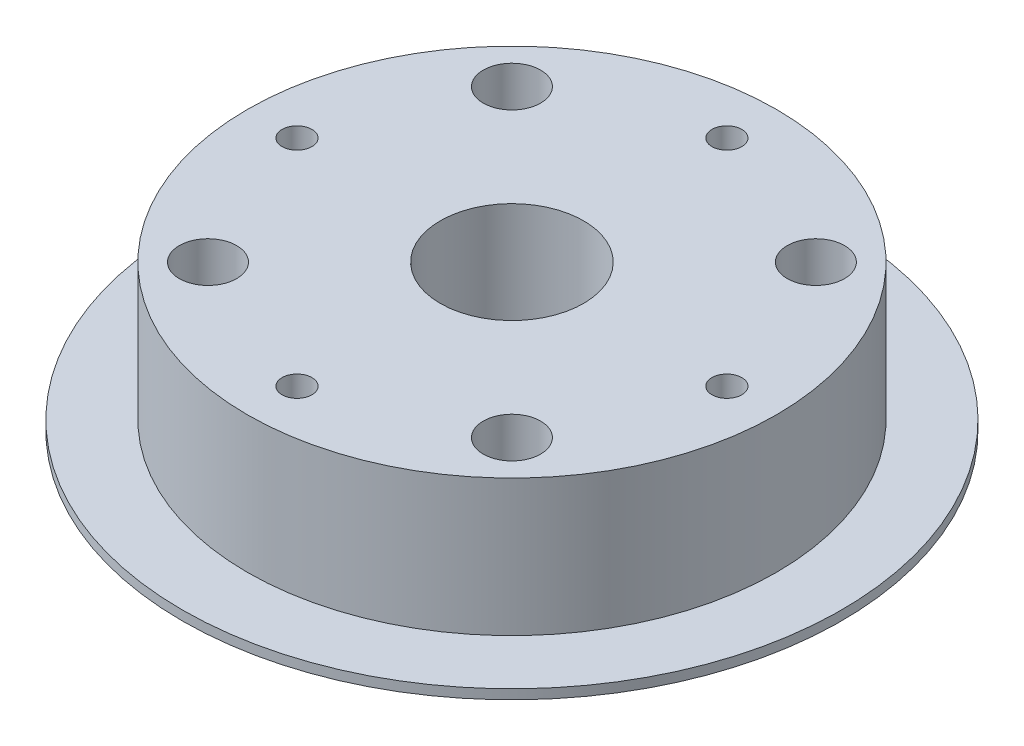
from build123d import *

# Parameters (mm, degrees)
SKETCH1_R           = 34.5
SKETCH1_R_2         = 1.5635
SKETCH1_R_3         = 7.5
BOSS_EXTRUDE1_DEPTH = 1
BOSS_EXTRUDE2_START = 14.2875
SKETCH1_3_R         = 27.69
SKETCH1_3_R_2       = 7.5
SKETCH1_3_R_3       = 1.5635
BOSS_EXTRUDE2_DEPTH = 14.2875
SKETCH2_R           = 3
SKETCH2_R_2         = 1.5635
CUT_EXTRUDE1_DEPTH  = 4.7625
CUT_EXTRUDE4_START  = -1
CUT_EXTRUDE4_DEPTH  = 4.7625


with BuildPart() as part:
    # Sketch1 → Boss-Extrude1 (new body)
    with BuildSketch(Plane(origin=(0, 0, 0), x_dir=(1, 0, 0), z_dir=(0, 1, 0))):
        Circle(SKETCH1_R)
        with Locations((22.5, 0)):
            Circle(SKETCH1_R_2, mode=Mode.SUBTRACT)
        with Locations((-15.909902577, -15.909902577)):
            Circle(SKETCH1_R_2, mode=Mode.SUBTRACT)
        with Locations((0, -22.5)):
            Circle(SKETCH1_R_2, mode=Mode.SUBTRACT)
        with Locations((15.909902577, -15.909902577)):
            Circle(SKETCH1_R_2, mode=Mode.SUBTRACT)
        with Locations((-22.5, 0)):
            Circle(SKETCH1_R_2, mode=Mode.SUBTRACT)
        with Locations((-15.909902577, 15.909902577)):
            Circle(SKETCH1_R_2, mode=Mode.SUBTRACT)
        with Locations((0, 22.5)):
            Circle(SKETCH1_R_2, mode=Mode.SUBTRACT)
        with Locations((15.909902577, 15.909902577)):
            Circle(SKETCH1_R_2, mode=Mode.SUBTRACT)
        Circle(SKETCH1_R_3, mode=Mode.SUBTRACT)
    extrude(amount=-BOSS_EXTRUDE1_DEPTH)

    # Sketch1<3> → Boss-Extrude2 (add)
    with BuildSketch(Plane(origin=(0, 0, 0), x_dir=(1, 0, 0), z_dir=(0, 1, 0)).offset(BOSS_EXTRUDE2_START)):
        Circle(SKETCH1_3_R)
        Circle(SKETCH1_3_R_2, mode=Mode.SUBTRACT)
        with Locations((-15.909902577, -15.909902577)):
            Circle(SKETCH1_3_R_3, mode=Mode.SUBTRACT)
        with Locations((0, -22.5)):
            Circle(SKETCH1_3_R_3, mode=Mode.SUBTRACT)
        with Locations((15.909902577, -15.909902577)):
            Circle(SKETCH1_3_R_3, mode=Mode.SUBTRACT)
        with Locations((-22.5, 0)):
            Circle(SKETCH1_3_R_3, mode=Mode.SUBTRACT)
        with Locations((-15.909902577, 15.909902577)):
            Circle(SKETCH1_3_R_3, mode=Mode.SUBTRACT)
        with Locations((0, 22.5)):
            Circle(SKETCH1_3_R_3, mode=Mode.SUBTRACT)
        with Locations((22.5, 0)):
            Circle(SKETCH1_3_R_3, mode=Mode.SUBTRACT)
        with Locations((15.909902577, 15.909902577)):
            Circle(SKETCH1_3_R_3, mode=Mode.SUBTRACT)
    extrude(amount=-BOSS_EXTRUDE2_DEPTH)

    # Sketch2 → Cut-Extrude1 (cut)
    # profile 1 of 4: a face of its own
    with BuildSketch(Plane(origin=(0, 14.2875, 0), x_dir=(1, 0, 0), z_dir=(0, 1, 0))):
        with Locations((15.909902577, 15.909902577)):
            Circle(SKETCH2_R)
        with Locations((15.909902577, 15.909902577)):
            Circle(SKETCH2_R_2, mode=Mode.SUBTRACT)
    # profile 2 of 4: a face of its own
    with BuildSketch(Plane(origin=(0, 14.2875, 0), x_dir=(1, 0, 0), z_dir=(0, 1, 0))):
        with Locations((15.909902577, -15.909902577)):
            Circle(SKETCH2_R)
    # profile 3 of 4: a face of its own
    with BuildSketch(Plane(origin=(0, 14.2875, 0), x_dir=(1, 0, 0), z_dir=(0, 1, 0))):
        with Locations((-15.909902577, -15.909902577)):
            Circle(SKETCH2_R)
        with Locations((-15.909902577, -15.909902577)):
            Circle(SKETCH2_R_2, mode=Mode.SUBTRACT)
    # profile 4 of 4: a face of its own
    with BuildSketch(Plane(origin=(0, 14.2875, 0), x_dir=(1, 0, 0), z_dir=(0, 1, 0))):
        with Locations((-15.909902577, 15.909902577)):
            Circle(SKETCH2_R)
        with Locations((-15.909902577, 15.909902577)):
            Circle(SKETCH2_R_2, mode=Mode.SUBTRACT)
    extrude(amount=-CUT_EXTRUDE1_DEPTH, mode=Mode.SUBTRACT)

    # Sketch4 → Cut-Extrude4 (cut)
    with BuildSketch(Plane.XZ.offset(1).offset(CUT_EXTRUDE4_START)):
        Polygon((22.5, 3.117691454), (19.8, 1.558845727), (19.8, -1.558845727), (22.5, -3.117691454), (25.2, -1.558845727), (25.2, 1.558845727), align=None)
        Polygon((1.558845727, 25.2), (-1.558845727, 25.2), (-3.117691454, 22.5), (-1.558845727, 19.8), (1.558845727, 19.8), (3.117691454, 22.5), align=None)
        Polygon((3.117691454, -22.5), (1.558845727, -19.8), (-1.558845727, -19.8), (-3.117691454, -22.5), (-1.558845727, -25.2), (1.558845727, -25.2), align=None)
        Polygon((-22.5, -3.117691454), (-19.8, -1.558845727), (-19.8, 1.558845727), (-22.5, 3.117691454), (-25.2, 1.558845727), (-25.2, -1.558845727), align=None)
    extrude(amount=-CUT_EXTRUDE4_DEPTH, mode=Mode.SUBTRACT)


solid = part.part
